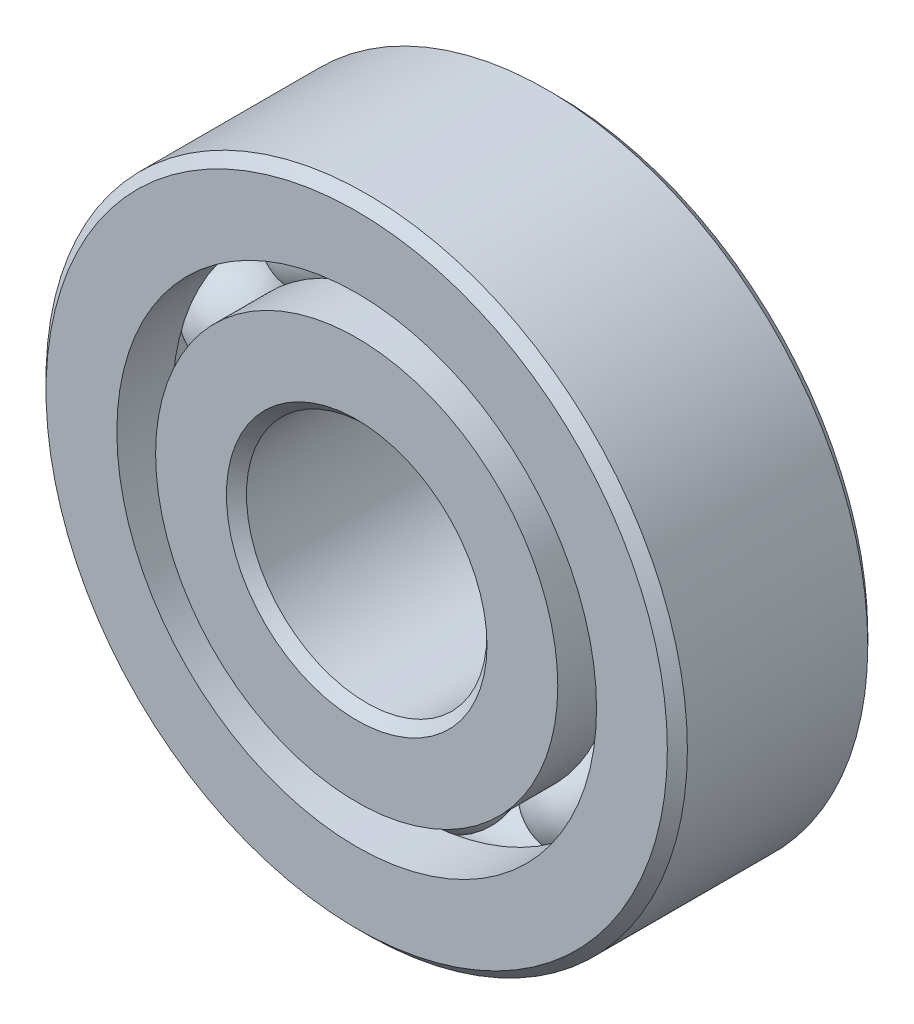
from build123d import *

# Parameters (mm, degrees)
CIRPATTERN1_COUNT = 10


with BuildPart() as part:
    # Sketch1 → Revolve1 (revolve)
    with BuildSketch(Plane(origin=(0, 0, 0), x_dir=(0, 0, -1), z_dir=(1, 0, 0))):
        with BuildLine():
            Line((1.7859375, 6.35), (-1.7859375, 6.35))
            Line((-1.7859375, 6.35), (-1.984375, 6.1515625))
            Line((-1.984375, 6.1515625), (-1.984375, 4.749416209))
            Line((-1.984375, 4.749416209), (-0.881944444, 4.749416209))
            ThreePointArc((-0.881944444, 4.749416209), (0, 5.327457467), (0.881944444, 4.749416209))
            Line((0.881944444, 4.749416209), (1.984375, 4.749416209))
            Line((1.984375, 4.749416209), (1.984375, 6.1515625))
            Line((1.984375, 6.1515625), (1.7859375, 6.35))
        make_face()
    revolve(axis=Axis((0, 0, 1.984375), (0, 0, -1)))


with BuildPart() as body_2:
    # Sketch3 → Revolve3 (revolve)
    with BuildSketch(Plane(origin=(0, 0, 0), x_dir=(0, 0, -1), z_dir=(1, 0, 0))):
        with BuildLine():
            Line((-1.984375, 3.981833791), (-0.881944444, 3.981833791))
            ThreePointArc((-0.881944444, 3.981833791), (0, 3.403792533), (0.881944444, 3.981833791))
            Line((0.881944444, 3.981833791), (1.984375, 3.981833791))
            Line((1.984375, 3.981833791), (1.984375, 2.5796875))
            Line((1.984375, 2.5796875), (1.7859375, 2.38125))
            Line((1.7859375, 2.38125), (-1.7859375, 2.38125))
            Line((-1.7859375, 2.38125), (-1.984375, 2.5796875))
            Line((-1.984375, 2.5796875), (-1.984375, 3.981833791))
        make_face()
    revolve(axis=Axis((0, 0, 1.984375), (0, 0, -1)))


with BuildPart() as body_3:
    # Sketch4 → Revolve4 (revolve)
    with BuildSketch(Plane(origin=(0, 0, 0), x_dir=(0, 0, -1), z_dir=(1, 0, 0))):
        with BuildLine():
            Line((-0.961832467, 4.365625), (0.961832467, 4.365625))
            ThreePointArc((0.961832467, 4.365625), (0, 5.327457467), (-0.961832467, 4.365625))
        make_face()
    revolve(axis=Axis((0, 4.365625, 0.961832467), (0, 0, -1)))


with BuildPart() as cirpattern1_1:
    # CirPattern1: pattern copy
    add(body_3.part.rotate(Axis((0, 0, -1.984375), (0, 0, 1)), 1 * 360 / CIRPATTERN1_COUNT))


with BuildPart() as cirpattern1_2:
    # CirPattern1: pattern copy
    add(body_3.part.rotate(Axis((0, 0, -1.984375), (0, 0, 1)), 2 * 360 / CIRPATTERN1_COUNT))


with BuildPart() as cirpattern1_3:
    # CirPattern1: pattern copy
    add(body_3.part.rotate(Axis((0, 0, -1.984375), (0, 0, 1)), 3 * 360 / CIRPATTERN1_COUNT))


with BuildPart() as cirpattern1_4:
    # CirPattern1: pattern copy
    add(body_3.part.rotate(Axis((0, 0, -1.984375), (0, 0, 1)), 4 * 360 / CIRPATTERN1_COUNT))


with BuildPart() as cirpattern1_5:
    # CirPattern1: pattern copy
    add(body_3.part.rotate(Axis((0, 0, -1.984375), (0, 0, 1)), 5 * 360 / CIRPATTERN1_COUNT))


with BuildPart() as cirpattern1_6:
    # CirPattern1: pattern copy
    add(body_3.part.rotate(Axis((0, 0, -1.984375), (0, 0, 1)), 6 * 360 / CIRPATTERN1_COUNT))


with BuildPart() as cirpattern1_7:
    # CirPattern1: pattern copy
    add(body_3.part.rotate(Axis((0, 0, -1.984375), (0, 0, 1)), 7 * 360 / CIRPATTERN1_COUNT))


with BuildPart() as cirpattern1_8:
    # CirPattern1: pattern copy
    add(body_3.part.rotate(Axis((0, 0, -1.984375), (0, 0, 1)), 8 * 360 / CIRPATTERN1_COUNT))


with BuildPart() as cirpattern1_9:
    # CirPattern1: pattern copy
    add(body_3.part.rotate(Axis((0, 0, -1.984375), (0, 0, 1)), 9 * 360 / CIRPATTERN1_COUNT))


solid = Compound([part.part, body_2.part, body_3.part, cirpattern1_1.part, cirpattern1_2.part, cirpattern1_3.part, cirpattern1_4.part, cirpattern1_5.part, cirpattern1_6.part, cirpattern1_7.part, cirpattern1_8.part, cirpattern1_9.part])
